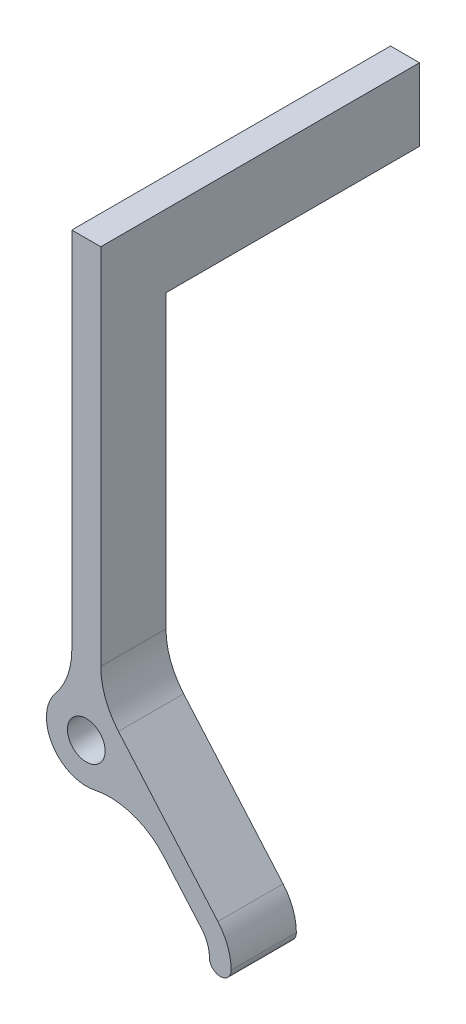
from build123d import *

# Parameters (mm, degrees)
SKETCH1_R           = 2.6
BOSS_EXTRUDE1_DEPTH = 9
FILLET1_R           = 10
SKETCH2_W           = 4
SKETCH2_H           = 10
BOSS_EXTRUDE2_DEPTH = 35


with BuildPart() as part:
    # Sketch1 → Boss-Extrude1 (new body)
    with BuildSketch(Plane.XY):
        with BuildLine():
            Line((4.158841106, 3.599172218), (18.171146962, -12.592037884))
            ThreePointArc((18.171146962, -12.592037884), (19.527930073, -14.881183685), (20, -17.5))
            ThreePointArc((20, -17.5), (18.5, -19), (17, -17.5))
            ThreePointArc((17, -17.5), (16.716758044, -15.928710211), (15.902688177, -14.55522273))
            Line((15.902688177, -14.55522273), (5.09624975, -2.068390312))
            ThreePointArc((5.09624975, -2.068390312), (-3.915025373, -3.862975062), (-2, 5.123475383))
            Line((-2, 5.123475383), (-2, 60))
            Line((-2, 60), (2, 60))
            Line((2, 60), (2, 5.123475383))
            ThreePointArc((2, 5.123475383), (3.172334468, 4.492915982), (4.158841106, 3.599172218))
        make_face()
        Circle(SKETCH1_R, mode=Mode.SUBTRACT)
    extrude(amount=BOSS_EXTRUDE1_DEPTH)

    # Fillet1
    fillet1_edges = [part.edges().sort_by_distance(p)[0] for p in [
        (5.09624975, -2.068390312, 4.5),
        (-2, 5.123475383, 4.5),
        (2, 5.123475383, 4.5),
    ]]
    fillet(fillet1_edges, radius=FILLET1_R)

    # Sketch2 → Boss-Extrude2 (add)
    with BuildSketch(Plane(origin=(0, 0, 0), x_dir=(-1, 0, 0), z_dir=(0, 0, -1))):
        with Locations((0, 55)):
            Rectangle(SKETCH2_W, SKETCH2_H)
    extrude(amount=BOSS_EXTRUDE2_DEPTH)


solid = part.part
